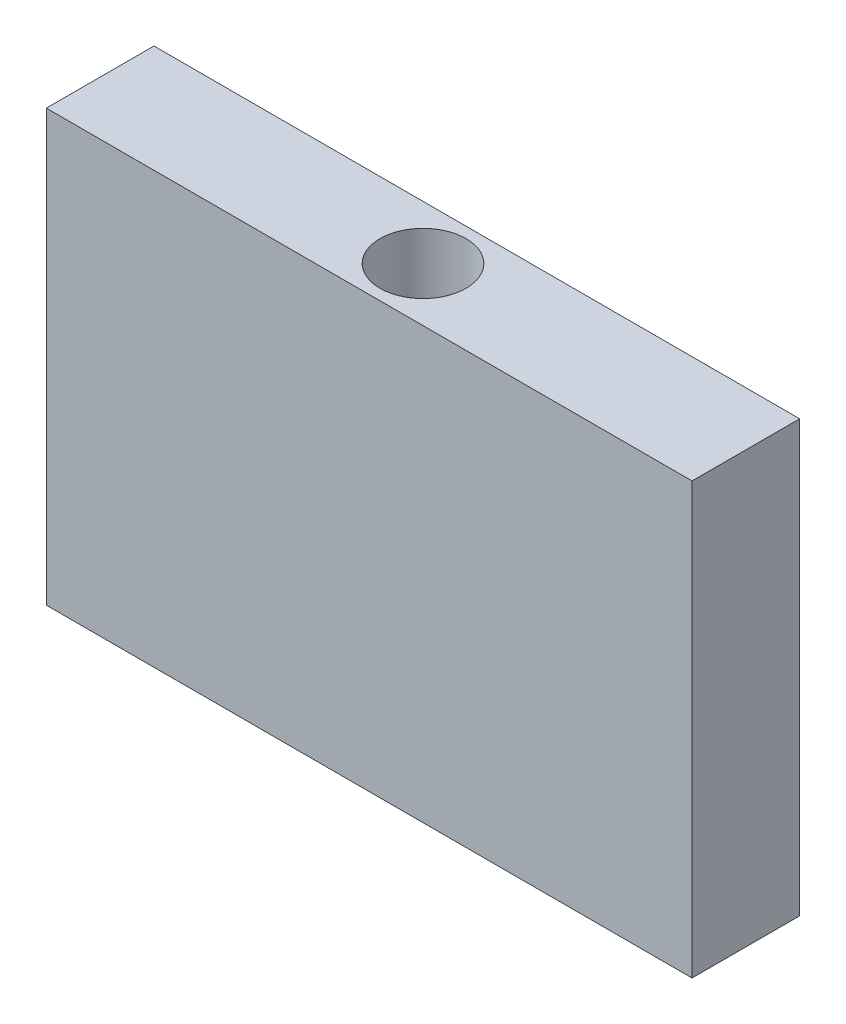
from build123d import *

# Parameters (mm, degrees)
SKETCH2_W           = 60
SKETCH2_H           = 10
SKETCH2_R           = 4
BOSS_EXTRUDE1_DEPTH = 40
SKETCH2_2_W         = 60
SKETCH2_2_H         = 10
SKETCH2_2_R         = 4
BOSS_EXTRUDE2_DEPTH = 25.5


with BuildPart() as part:
    # Sketch2 → Boss-Extrude1 (new body)
    with BuildSketch(Plane(origin=(0, 0, 0), x_dir=(1, 0, 0), z_dir=(0, 1, 0))):
        Rectangle(SKETCH2_W, SKETCH2_H)
        Circle(SKETCH2_R, mode=Mode.SUBTRACT)
    extrude(amount=BOSS_EXTRUDE1_DEPTH)

    # Sketch2<2> → Boss-Extrude2 (add)
    with BuildSketch(Plane(origin=(0, 0, 0), x_dir=(1, 0, 0), z_dir=(0, 1, 0))):
        Rectangle(SKETCH2_2_W, SKETCH2_2_H)
        Circle(SKETCH2_2_R, mode=Mode.SUBTRACT)
    extrude(amount=BOSS_EXTRUDE2_DEPTH)


solid = part.part
